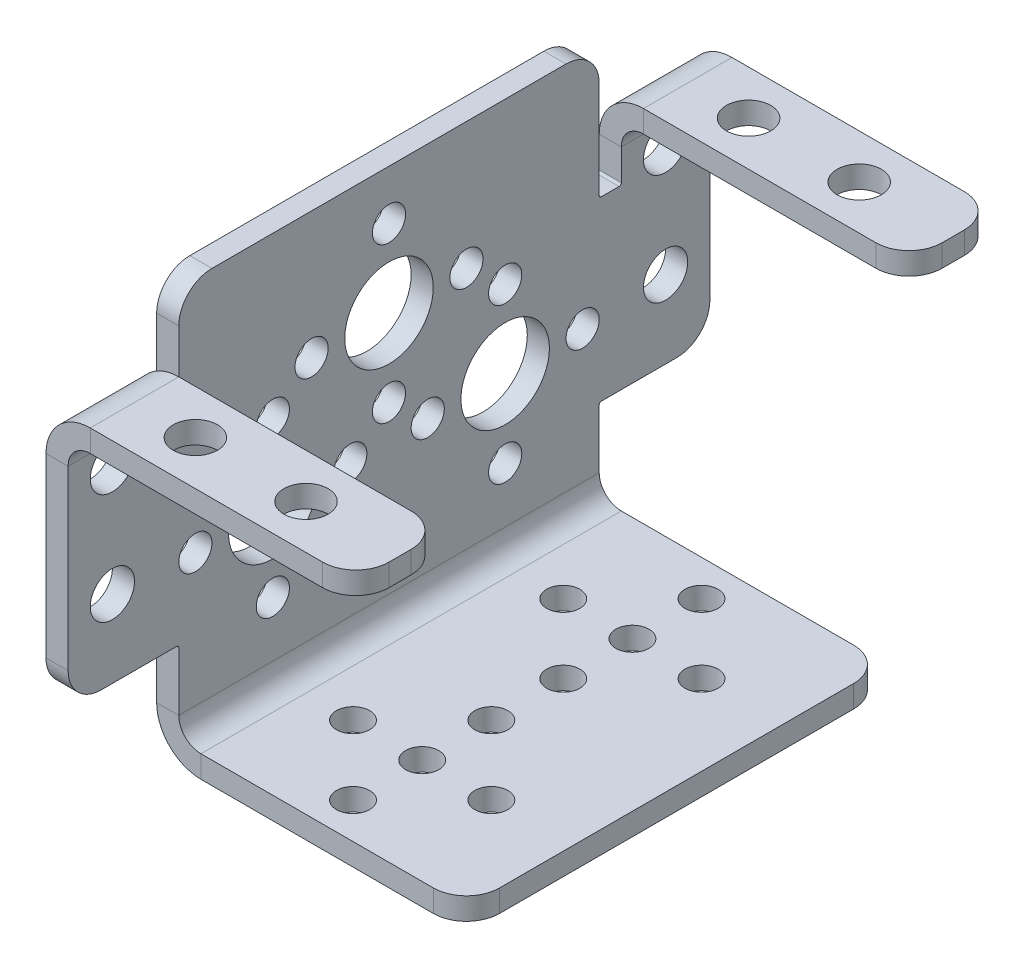
from build123d import *

# Parameters (mm, degrees)
BOSS_EXTRUDE1_DEPTH            = 1
CONVERT_SOLID1_START           = -1
CONVERT_SOLID1_DEPTH           = 1
EDGE_FLANGE1_STRIP_W           = 12
EDGE_FLANGE1_STRIP_H           = 2
EDGE_FLANGE1_STRIP_CUT_DEPTH   = 38
EDGE_FLANGE1_DEPTH             = 38
EDGE_FLANGE2_STRIP_W           = 12
EDGE_FLANGE2_STRIP_H           = 2
EDGE_FLANGE2_STRIP_CUT_DEPTH   = 8
EDGE_FLANGE2_STRIP_2_W         = 12
EDGE_FLANGE2_STRIP_2_H         = 2
EDGE_FLANGE2_STRIP_CUT_2_DEPTH = 8
EDGE_FLANGE2_DEPTH             = 8
EDGE_FLANGE2_BEND_DEPTH        = 8
FILLET1_R                      = 3
M3X0_5_TAPPED_HOLE1_D          = 3
SKETCH20_R                     = 4
CUT_EXTRUDE1_DEPTH             = 44.667665669
M4X0_7_TAPPED_HOLE1_D          = 4
M4X0_7_TAPPED_HOLE2_D          = 4
M3X0_5_TAPPED_HOLE2_D          = 3
FILLET2_R                      = 0.2


# Read off the part's stored shape, not the designer's step: Convert-Solid1
# Sheet-metal steps are written as plain solids
with BuildPart() as part:
    # Sketch1 → Boss-Extrude1 (new body)
    with BuildSketch(Plane(origin=(0, 0, 0), x_dir=(0, 0, -1), z_dir=(1, 0, 0))):
        with BuildLine():
            Line((-19, -17.745), (19, -17.745))
            Line((19, -17.745), (19, -10.245))
            Line((19, -10.245), (26, -10.245))
            ThreePointArc((26, -10.245), (28.121320344, -9.366320344), (29, -7.245))
            Line((29, -7.245), (29, 10.755))
            Line((29, 10.755), (21, 10.755))
            Line((21, 10.755), (21, 5.755))
            Line((21, 5.755), (19, 5.755))
            Line((19, 5.755), (19, 14.745))
            ThreePointArc((19, 14.745), (18.121320344, 16.866320344), (16, 17.745))
            Line((16, 17.745), (-16, 17.745))
            ThreePointArc((-16, 17.745), (-18.121320344, 16.866320344), (-19, 14.745))
            Line((-19, 14.745), (-19, 5.755))
            Line((-19, 5.755), (-21, 5.755))
            Line((-21, 5.755), (-21, 10.755))
            Line((-21, 10.755), (-29, 10.755))
            Line((-29, 10.755), (-29, -7.245))
            ThreePointArc((-29, -7.245), (-28.121320344, -9.366320344), (-26, -10.245))
            Line((-26, -10.245), (-19, -10.245))
            Line((-19, -10.245), (-19, -17.745))
        make_face()
    extrude(amount=BOSS_EXTRUDE1_DEPTH)

    # Convert-Solid1 outline → Convert-Solid1 (add)
    with BuildSketch(Plane.YZ.offset(CONVERT_SOLID1_START)):
        with BuildLine():
            Line((17.745, -16), (17.745, 16))
            ThreePointArc((17.745, 16), (16.866320344, 18.121320344), (14.745, 19))
            Line((14.745, 19), (5.755, 19))
            Line((5.755, 19), (5.755, 21))
            Line((5.755, 21), (10.755, 21))
            Line((10.755, 21), (10.755, 29))
            Line((10.755, 29), (-7.245, 29))
            ThreePointArc((-7.245, 29), (-9.366320344, 28.121320344), (-10.245, 26))
            Line((-10.245, 26), (-10.245, 19))
            Line((-10.245, 19), (-17.745, 19))
            Line((-17.745, 19), (-17.745, -19))
            Line((-17.745, -19), (-10.245, -19))
            Line((-10.245, -19), (-10.245, -26))
            ThreePointArc((-10.245, -26), (-9.366320344, -28.121320344), (-7.245, -29))
            Line((-7.245, -29), (10.755, -29))
            Line((10.755, -29), (10.755, -21))
            Line((10.755, -21), (5.755, -21))
            Line((5.755, -21), (5.755, -19))
            Line((5.755, -19), (14.745, -19))
            ThreePointArc((14.745, -19), (16.866320344, -18.121320344), (17.745, -16))
        make_face()
    extrude(amount=CONVERT_SOLID1_DEPTH)

    # Edge-Flange1 strip (across the edge) → Edge-Flange1 strip cut (cut)
    with BuildSketch(Plane(origin=(1, -17.745, 19), x_dir=(0, 1, 0), z_dir=(0, 0, -1))):
        with Locations((-4, -1)):
            Rectangle(EDGE_FLANGE1_STRIP_W, EDGE_FLANGE1_STRIP_H)
    extrude(amount=EDGE_FLANGE1_STRIP_CUT_DEPTH, mode=Mode.SUBTRACT)

    # Edge-Flange1 section (across the edge) → Edge-Flange1 (add)
    with BuildSketch(Plane(origin=(1, -17.745, 19), x_dir=(0, 1, 0), z_dir=(0, 0, -1))):
        with BuildLine():
            Line((-2, 2), (-2, 26))
            Line((-2, 26), (0, 26))
            Line((0, 26), (0, 2))
            ThreePointArc((0, 2), (0.585786438, 0.585786438), (2, 0))
            Line((2, 0), (2, -2))
            ThreePointArc((2, -2), (-0.828427125, -0.828427125), (-2, 2))
        make_face()
    extrude(amount=EDGE_FLANGE1_DEPTH)

    # Edge-Flange2 strip (across the edge) → Edge-Flange2 strip cut (cut)
    with BuildSketch(Plane(origin=(1, 10.755, 21), x_dir=(0, -1, 0), z_dir=(0, 0, 1))):
        with Locations((-4, -1)):
            Rectangle(EDGE_FLANGE2_STRIP_W, EDGE_FLANGE2_STRIP_H)
    extrude(amount=EDGE_FLANGE2_STRIP_CUT_DEPTH, mode=Mode.SUBTRACT)

    # Edge-Flange2 strip 2 (across the edge) → Edge-Flange2 strip cut 2 (cut)
    with BuildSketch(Plane(origin=(1, 10.755, -29), x_dir=(0, -1, 0), z_dir=(0, 0, 1))):
        with Locations((-4, -1)):
            Rectangle(EDGE_FLANGE2_STRIP_2_W, EDGE_FLANGE2_STRIP_2_H)
    extrude(amount=EDGE_FLANGE2_STRIP_CUT_2_DEPTH, mode=Mode.SUBTRACT)

    # Edge-Flange2 section (across the edge) → Edge-Flange2 (add)
    with BuildSketch(Plane(origin=(1, 10.755, 21), x_dir=(0, -1, 0), z_dir=(0, 0, 1))):
        with BuildLine():
            Line((-2, 2), (-2, 26))
            Line((-2, 26), (0, 26))
            Line((0, 26), (0, 2))
            ThreePointArc((0, 2), (0.585786438, 0.585786438), (2, 0))
            Line((2, 0), (2, -2))
            ThreePointArc((2, -2), (-0.828427125, -0.828427125), (-2, 2))
        make_face()
    extrude(amount=EDGE_FLANGE2_DEPTH)

    # Edge-Flange2 section 2 (across the edge) → Edge-Flange2 bend (add)
    with BuildSketch(Plane(origin=(1, 10.755, -29), x_dir=(0, -1, 0), z_dir=(0, 0, 1))):
        with BuildLine():
            Line((-2, 2), (-2, 26))
            Line((-2, 26), (0, 26))
            Line((0, 26), (0, 2))
            ThreePointArc((0, 2), (0.585786438, 0.585786438), (2, 0))
            Line((2, 0), (2, -2))
            ThreePointArc((2, -2), (-0.828427125, -0.828427125), (-2, 2))
        make_face()
    extrude(amount=EDGE_FLANGE2_BEND_DEPTH)

    # Fillet1
    fillet1_edges = [part.edges().sort_by_distance(p)[0] for p in [
        (27, 11.755, 21),
        (27, 11.755, 29),
        (27, 11.755, -29),
        (27, 11.755, -21),
        (27, -18.745, 19),
        (27, -18.745, -19),
    ]]
    fillet(fillet1_edges, radius=FILLET1_R)

    # M3x0.5 Tapped Hole1 (through all)
    with Locations(Plane(origin=(0, -19.745, 0), x_dir=(-1, 0, 0), z_dir=(0, -1, 0))):
        with Locations((-19.75, -9.5), (-7.25, -9.5), (-13.5, -9.5), (-13.5, -3.25), (-13.5, -15.75), (-7.25, 9.5), (-13.5, 3.25), (-19.75, 9.5), (-13.5, 9.5), (-13.5, 15.75)):
            Hole(M3X0_5_TAPPED_HOLE1_D / 2)

    # Sketch20 → Cut-Extrude1 (cut, through all)
    with BuildSketch(Plane(origin=(1, 0, 0), x_dir=(0, 0, -1), z_dir=(1, 0, 0))):
        with Locations((10.5, -3.745)):
            Circle(SKETCH20_R)
        with Locations((0, 6.255)):
            Circle(SKETCH20_R)
        with Locations((-10.5, -3.745)):
            Circle(SKETCH20_R)
    extrude(amount=-CUT_EXTRUDE1_DEPTH, mode=Mode.SUBTRACT)

    # M4x0.7 Tapped Hole1 (through all)
    with Locations(Plane(origin=(0, 10.755, 0), x_dir=(-1, 0, 0), z_dir=(0, -1, 0))):
        with Locations((-18.5, -25), (-8.5, -25), (-8.5, 25), (-18.5, 25)):
            Hole(M4X0_7_TAPPED_HOLE1_D / 2)

    # M4x0.7 Tapped Hole2 (through all)
    with Locations(Plane(origin=(1, 0, 0), x_dir=(0, 0, -1), z_dir=(1, 0, 0))):
        with Locations((25, -3.245), (25, 6.755), (-25, 6.755), (-25, -3.245)):
            Hole(M4X0_7_TAPPED_HOLE2_D / 2)

    # M3x0.5 Tapped Hole2 (through all)
    with Locations(Plane(origin=(1, 0, 0), x_dir=(0, 0, -1), z_dir=(1, 0, 0))):
        with Locations((-10.5, 3.255), (-10.5, -10.745), (-3.5, -3.745), (-17.5, -3.745), (0, 13.255), (0, -0.745), (7, 6.255), (-7, 6.255), (10.5, 3.255), (10.5, -10.745), (17.5, -3.745), (3.5, -3.745)):
            Hole(M3X0_5_TAPPED_HOLE2_D / 2)

    # Fillet2
    fillet2_edges = [part.edges().sort_by_distance(p)[0] for p in [
        (0, 5.755, -19),
        (0, 5.755, -21),
        (0, -10.245, -19),
        (0, -10.245, 19),
        (0, 5.755, 21),
        (0, 5.755, 19),
    ]]
    fillet(fillet2_edges, radius=FILLET2_R)


solid = part.part
